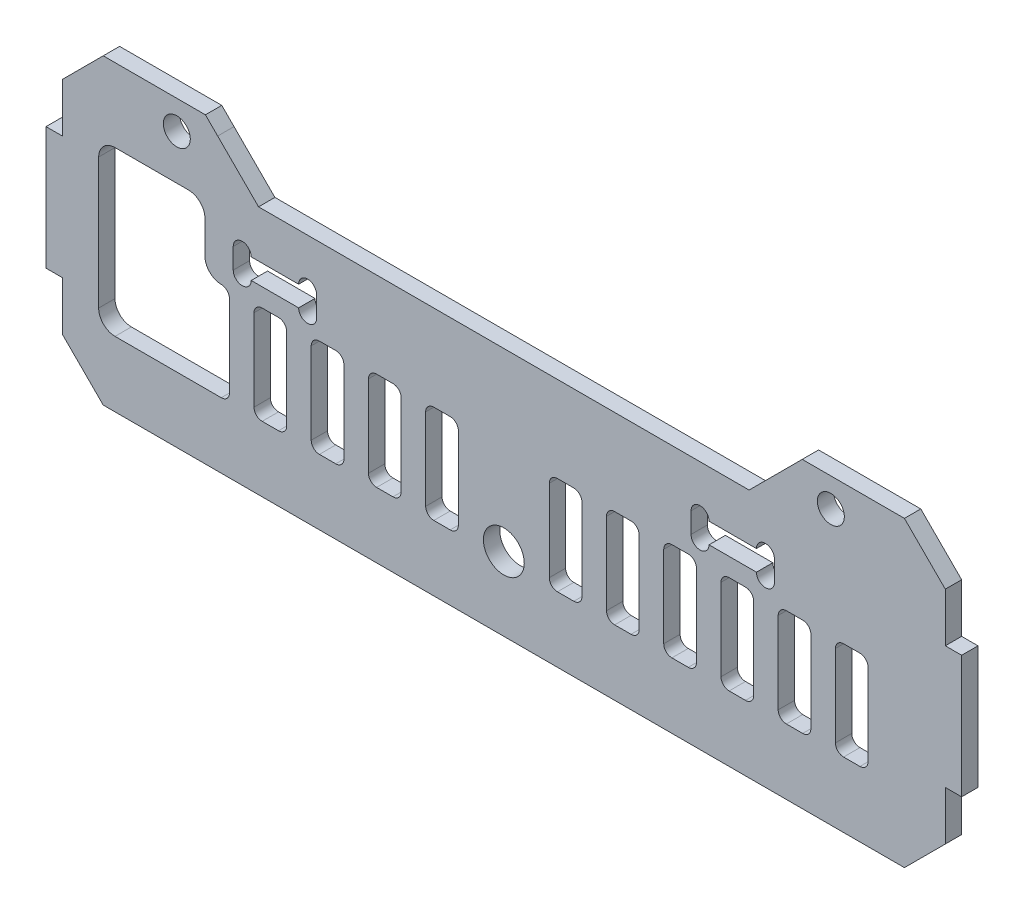
from build123d import *

# Parameters (mm, degrees)
SKETCH_1_W           = 105
SKETCH_1_H           = 43
EXTRUDE_1_DEPTH      = 2
SKETCH_2_R           = 2.5
CUT_EXTRUDE_1_DEPTH  = 2
SKETCH_3_R           = 1.65
CUT_EXTRUDE_2_DEPTH  = 2
CUT_EXTRUDE_3_DEPTH  = 2
CUT_EXTRUDE_4_DEPTH  = 2
SKETCH_7_W           = 119.420279411
SKETCH_7_H           = 10
CUT_EXTRUDE_6_DEPTH  = 2
SKETCH_8_W           = 4.11
SKETCH_8_H           = 33
CUT_EXTRUDE_7_DEPTH  = 2
SKETCH_11_W          = 2
SKETCH_11_H          = 15
EXTRUDE_2_DEPTH      = 2
SKETCH_13_W          = 96.78
SKETCH_13_H          = 6
CUT_EXTRUDE_8_DEPTH  = 2
SKETCH_14_W          = 96.78
SKETCH_14_H          = 10
EXTRUDE_3_DEPTH      = 2
SKETCH_15_R          = 1.65
CUT_EXTRUDE_9_DEPTH  = 10
SKETCH_17_W          = 70
SKETCH_17_H          = 13
CUT_EXTRUDE_10_DEPTH = 50
SKETCH_18_W          = 2
SKETCH_18_H          = 13
SKETCH_18_H_2        = 9
EXTRUDE_4_DEPTH      = 2
SKETCH_19_W          = 2
SKETCH_19_H          = 13
SKETCH_19_H_2        = 9
EXTRUDE_5_DEPTH      = 2
SKETCH_20_W          = 3.61
SKETCH_20_H          = 37
EXTRUDE_6_DEPTH      = 2
SKETCH_21_W          = 4
SKETCH_21_H          = 15
EXTRUDE_7_DEPTH      = 2
CHAMFER_1_SIZE       = 5
CHAMFER_2_SIZE       = 1.5
SKETCH_23_W          = 13
SKETCH_23_H          = 20
CUT_EXTRUDE_12_DEPTH = 10
FILLET_2_R           = 2


with BuildPart() as part:
    # 草图1 → 凸台-拉伸1 (new body)
    with BuildSketch(Plane.XY):
        Rectangle(SKETCH_1_W, SKETCH_1_H)
    extrude(amount=EXTRUDE_1_DEPTH)

    # 草图2 → 切除-拉伸1 (cut)
    with BuildSketch(Plane.XY.offset(2)):
        with Locations((0, -6.5)):
            Circle(SKETCH_2_R)
    extrude(amount=-CUT_EXTRUDE_1_DEPTH, mode=Mode.SUBTRACT)

    # 草图3 → 切除-拉伸2 (cut)
    with BuildSketch(Plane.XY.offset(2)):
        with Locations((-40, -18.5)):
            Circle(SKETCH_3_R)
        with Locations((-40, 13.5)):
            Circle(SKETCH_3_R)
        with Locations(Location((40, 13.5, 0), (0, 0, 180))):
            Circle(SKETCH_3_R)
        with Locations(Location((40, -18.5, 0), (0, 0, 180))):
            Circle(SKETCH_3_R)
    extrude(amount=-CUT_EXTRUDE_2_DEPTH, mode=Mode.SUBTRACT)

    # 草图4 → 切除-拉伸3 (cut)
    with BuildSketch(Plane.XY.offset(2)):
        with BuildLine():
            Line((-6.55922156, -7.5), (-8.55922156, -7.5))
            ThreePointArc((-8.55922156, -7.5), (-9.266328341, -7.207106781), (-9.55922156, -6.5))
            Line((-9.55922156, -6.5), (-9.55922156, 3.5))
            ThreePointArc((-9.55922156, 3.5), (-9.266328341, 4.207106781), (-8.55922156, 4.5))
            Line((-8.55922156, 4.5), (-6.55922156, 4.5))
            ThreePointArc((-6.55922156, 4.5), (-5.852114779, 4.207106781), (-5.55922156, 3.5))
            Line((-5.55922156, 3.5), (-5.55922156, -6.5))
            ThreePointArc((-5.55922156, -6.5), (-5.852114779, -7.207106781), (-6.55922156, -7.5))
        make_face()
        with BuildLine():
            Line((-12.55922156, -6.5), (-12.55922156, 3.5))
            ThreePointArc((-12.55922156, 3.5), (-12.852114779, 4.207106781), (-13.55922156, 4.5))
            Line((-13.55922156, 4.5), (-15.55922156, 4.5))
            ThreePointArc((-15.55922156, 4.5), (-16.266328341, 4.207106781), (-16.55922156, 3.5))
            Line((-16.55922156, 3.5), (-16.55922156, -6.5))
            ThreePointArc((-16.55922156, -6.5), (-16.266328341, -7.207106781), (-15.55922156, -7.5))
            Line((-15.55922156, -7.5), (-13.55922156, -7.5))
            ThreePointArc((-13.55922156, -7.5), (-12.852114779, -7.207106781), (-12.55922156, -6.5))
        make_face()
        with BuildLine():
            Line((-19.55922156, -6.5), (-19.55922156, 3.5))
            ThreePointArc((-19.55922156, 3.5), (-19.852114779, 4.207106781), (-20.55922156, 4.5))
            Line((-20.55922156, 4.5), (-22.55922156, 4.5))
            ThreePointArc((-22.55922156, 4.5), (-23.266328341, 4.207106781), (-23.55922156, 3.5))
            Line((-23.55922156, 3.5), (-23.55922156, -6.5))
            ThreePointArc((-23.55922156, -6.5), (-23.266328341, -7.207106781), (-22.55922156, -7.5))
            Line((-22.55922156, -7.5), (-20.55922156, -7.5))
            ThreePointArc((-20.55922156, -7.5), (-19.852114779, -7.207106781), (-19.55922156, -6.5))
        make_face()
        with BuildLine():
            Line((-26.55922156, -6.5), (-26.55922156, 3.5))
            ThreePointArc((-26.55922156, 3.5), (-26.852114779, 4.207106781), (-27.55922156, 4.5))
            Line((-27.55922156, 4.5), (-29.55922156, 4.5))
            ThreePointArc((-29.55922156, 4.5), (-30.266328341, 4.207106781), (-30.55922156, 3.5))
            Line((-30.55922156, 3.5), (-30.55922156, -6.5))
            ThreePointArc((-30.55922156, -6.5), (-30.266328341, -7.207106781), (-29.55922156, -7.5))
            Line((-29.55922156, -7.5), (-27.55922156, -7.5))
            ThreePointArc((-27.55922156, -7.5), (-26.852114779, -7.207106781), (-26.55922156, -6.5))
        make_face()
        with BuildLine():
            Line((-33.55922156, -6.5), (-33.55922156, 3.5))
            ThreePointArc((-33.55922156, 3.5), (-33.852114779, 4.207106781), (-34.55922156, 4.5))
            Line((-34.55922156, 4.5), (-36.55922156, 4.5))
            ThreePointArc((-36.55922156, 4.5), (-37.266328341, 4.207106781), (-37.55922156, 3.5))
            Line((-37.55922156, 3.5), (-37.55922156, -6.5))
            ThreePointArc((-37.55922156, -6.5), (-37.266328341, -7.207106781), (-36.55922156, -7.5))
            Line((-36.55922156, -7.5), (-34.55922156, -7.5))
            ThreePointArc((-34.55922156, -7.5), (-33.852114779, -7.207106781), (-33.55922156, -6.5))
        make_face()
        with BuildLine():
            Line((-40.55922156, -6.5), (-40.55922156, 3.5))
            ThreePointArc((-40.55922156, 3.5), (-40.852114779, 4.207106781), (-41.55922156, 4.5))
            Line((-41.55922156, 4.5), (-43.55922156, 4.5))
            ThreePointArc((-43.55922156, 4.5), (-44.266328341, 4.207106781), (-44.55922156, 3.5))
            Line((-44.55922156, 3.5), (-44.55922156, -6.5))
            ThreePointArc((-44.55922156, -6.5), (-44.266328341, -7.207106781), (-43.55922156, -7.5))
            Line((-43.55922156, -7.5), (-41.55922156, -7.5))
            ThreePointArc((-41.55922156, -7.5), (-40.852114779, -7.207106781), (-40.55922156, -6.5))
        make_face()
        with BuildLine():
            Line((41.55922156, 4.5), (43.55922156, 4.5))
            ThreePointArc((43.55922156, 4.5), (44.266328341, 4.207106781), (44.55922156, 3.5))
            Line((44.55922156, 3.5), (44.55922156, -6.5))
            ThreePointArc((44.55922156, -6.5), (44.266328341, -7.207106781), (43.55922156, -7.5))
            Line((43.55922156, -7.5), (41.55922156, -7.5))
            ThreePointArc((41.55922156, -7.5), (40.852114779, -7.207106781), (40.55922156, -6.5))
            Line((40.55922156, -6.5), (40.55922156, 3.5))
            ThreePointArc((40.55922156, 3.5), (40.852114779, 4.207106781), (41.55922156, 4.5))
        make_face()
        with BuildLine():
            Line((34.55922156, 4.5), (36.55922156, 4.5))
            ThreePointArc((36.55922156, 4.5), (37.266328341, 4.207106781), (37.55922156, 3.5))
            Line((37.55922156, 3.5), (37.55922156, -6.5))
            ThreePointArc((37.55922156, -6.5), (37.266328341, -7.207106781), (36.55922156, -7.5))
            Line((36.55922156, -7.5), (34.55922156, -7.5))
            ThreePointArc((34.55922156, -7.5), (33.852114779, -7.207106781), (33.55922156, -6.5))
            Line((33.55922156, -6.5), (33.55922156, 3.5))
            ThreePointArc((33.55922156, 3.5), (33.852114779, 4.207106781), (34.55922156, 4.5))
        make_face()
        with BuildLine():
            Line((27.55922156, 4.5), (29.55922156, 4.5))
            ThreePointArc((29.55922156, 4.5), (30.266328341, 4.207106781), (30.55922156, 3.5))
            Line((30.55922156, 3.5), (30.55922156, -6.5))
            ThreePointArc((30.55922156, -6.5), (30.266328341, -7.207106781), (29.55922156, -7.5))
            Line((29.55922156, -7.5), (27.55922156, -7.5))
            ThreePointArc((27.55922156, -7.5), (26.852114779, -7.207106781), (26.55922156, -6.5))
            Line((26.55922156, -6.5), (26.55922156, 3.5))
            ThreePointArc((26.55922156, 3.5), (26.852114779, 4.207106781), (27.55922156, 4.5))
        make_face()
        with BuildLine():
            Line((20.55922156, 4.5), (22.55922156, 4.5))
            ThreePointArc((22.55922156, 4.5), (23.266328341, 4.207106781), (23.55922156, 3.5))
            Line((23.55922156, 3.5), (23.55922156, -6.5))
            ThreePointArc((23.55922156, -6.5), (23.266328341, -7.207106781), (22.55922156, -7.5))
            Line((22.55922156, -7.5), (20.55922156, -7.5))
            ThreePointArc((20.55922156, -7.5), (19.852114779, -7.207106781), (19.55922156, -6.5))
            Line((19.55922156, -6.5), (19.55922156, 3.5))
            ThreePointArc((19.55922156, 3.5), (19.852114779, 4.207106781), (20.55922156, 4.5))
        make_face()
        with BuildLine():
            Line((13.55922156, 4.5), (15.55922156, 4.5))
            ThreePointArc((15.55922156, 4.5), (16.266328341, 4.207106781), (16.55922156, 3.5))
            Line((16.55922156, 3.5), (16.55922156, -6.5))
            ThreePointArc((16.55922156, -6.5), (16.266328341, -7.207106781), (15.55922156, -7.5))
            Line((15.55922156, -7.5), (13.55922156, -7.5))
            ThreePointArc((13.55922156, -7.5), (12.852114779, -7.207106781), (12.55922156, -6.5))
            Line((12.55922156, -6.5), (12.55922156, 3.5))
            ThreePointArc((12.55922156, 3.5), (12.852114779, 4.207106781), (13.55922156, 4.5))
        make_face()
        with BuildLine():
            Line((9.55922156, -6.5), (9.55922156, 3.5))
            ThreePointArc((9.55922156, 3.5), (9.266328341, 4.207106781), (8.55922156, 4.5))
            Line((8.55922156, 4.5), (6.55922156, 4.5))
            ThreePointArc((6.55922156, 4.5), (5.852114779, 4.207106781), (5.55922156, 3.5))
            Line((5.55922156, 3.5), (5.55922156, -6.5))
            ThreePointArc((5.55922156, -6.5), (5.852114779, -7.207106781), (6.55922156, -7.5))
            Line((6.55922156, -7.5), (8.55922156, -7.5))
            ThreePointArc((8.55922156, -7.5), (9.266328341, -7.207106781), (9.55922156, -6.5))
        make_face()
    extrude(amount=-CUT_EXTRUDE_3_DEPTH, mode=Mode.SUBTRACT)

    # 草图5 → 切除-拉伸4 (cut)
    with BuildSketch(Plane.XY.offset(2)):
        with BuildLine():
            Line((-25.100000106, 6.749999873), (-30.900000106, 6.749999873))
            ThreePointArc((-30.900000106, 6.749999873), (-32.000000106, 5.649999873), (-33.100000106, 6.749999873))
            Line((-33.100000106, 6.749999873), (-33.100000106, 9.249999977))
            ThreePointArc((-33.100000106, 9.249999977), (-32.000000106, 10.349999977), (-30.900000106, 9.249999977))
            Line((-30.900000106, 9.249999977), (-25.100000106, 9.249999977))
            ThreePointArc((-25.100000106, 9.249999977), (-24.000000156, 10.349999977), (-22.900000106, 9.250000075))
            Line((-22.900000106, 9.250000075), (-22.900000106, 6.750000075))
            ThreePointArc((-22.900000106, 6.750000075), (-24.000000005, 5.649999873), (-25.100000106, 6.749999873))
        make_face()
        with BuildLine():
            Line((22.900000106, 6.750000075), (22.900000106, 9.250000075))
            ThreePointArc((22.900000106, 9.250000075), (24.000000156, 10.349999977), (25.100000106, 9.249999977))
            Line((25.100000106, 9.249999977), (30.900000106, 9.249999977))
            ThreePointArc((30.900000106, 9.249999977), (32.000000106, 10.349999977), (33.100000106, 9.249999977))
            Line((33.100000106, 9.249999977), (33.100000106, 6.749999873))
            ThreePointArc((33.100000106, 6.749999873), (32.000000106, 5.649999873), (30.900000106, 6.749999873))
            Line((30.900000106, 6.749999873), (25.100000106, 6.749999873))
            ThreePointArc((25.100000106, 6.749999873), (24.000000005, 5.649999873), (22.900000106, 6.750000075))
        make_face()
    extrude(amount=-CUT_EXTRUDE_4_DEPTH, mode=Mode.SUBTRACT)

    # 草图7 → 切除-拉伸6 (cut)
    with BuildSketch(Plane.XY.offset(2)):
        with Locations((5.815039628, 16.5)):
            Rectangle(SKETCH_7_W, SKETCH_7_H)
    extrude(amount=-CUT_EXTRUDE_6_DEPTH, mode=Mode.SUBTRACT)

    # 草图8 → 切除-拉伸7 (cut)
    with BuildSketch(Plane.XY.offset(2)):
        with Locations((-50.445, -5)):
            Rectangle(SKETCH_8_W, SKETCH_8_H)
        with Locations((50.445, -5)):
            Rectangle(SKETCH_8_W, SKETCH_8_H)
    extrude(amount=-CUT_EXTRUDE_7_DEPTH, mode=Mode.SUBTRACT)

    # 草图11 → 凸台-拉伸2 (add)
    with BuildSketch(Plane.XY.offset(2)):
        with Locations((-49.39, 1)):
            Rectangle(SKETCH_11_W, SKETCH_11_H)
        with Locations((49.39, 1)):
            Rectangle(SKETCH_11_W, SKETCH_11_H)
    extrude(amount=-EXTRUDE_2_DEPTH)

    # 草图13 → 切除-拉伸8 (cut)
    with BuildSketch(Plane(origin=(0, 0, 0), x_dir=(-1, 0, 0), z_dir=(0, 0, -1))):
        with Locations((0, -18.5)):
            Rectangle(SKETCH_13_W, SKETCH_13_H)
    extrude(amount=-CUT_EXTRUDE_8_DEPTH, mode=Mode.SUBTRACT)

    # 草图14 → 凸台-拉伸3 (add)
    with BuildSketch(Plane(origin=(0, 0, 0), x_dir=(-1, 0, 0), z_dir=(0, 0, -1))):
        with Locations((0, 16.5)):
            Rectangle(SKETCH_14_W, SKETCH_14_H)
    extrude(amount=-EXTRUDE_3_DEPTH)

    # 草图15 → 切除-拉伸9 (cut)
    with BuildSketch(Plane(origin=(0, 0, 0), x_dir=(-1, 0, 0), z_dir=(0, 0, -1))):
        with Locations((-40, 18)):
            Circle(SKETCH_15_R)
        with Locations((40, 18)):
            Circle(SKETCH_15_R)
    extrude(amount=-CUT_EXTRUDE_9_DEPTH, mode=Mode.SUBTRACT)

    # 草图17 → 切除-拉伸10 (cut)
    with BuildSketch(Plane(origin=(0, 0, 0), x_dir=(-1, 0, 0), z_dir=(0, 0, -1))):
        with Locations((0, 21.5)):
            Rectangle(SKETCH_17_W, SKETCH_17_H)
    extrude(amount=-CUT_EXTRUDE_10_DEPTH, mode=Mode.SUBTRACT)

    # 草图18 → 凸台-拉伸4 (add)
    with BuildSketch(Plane.ZY.offset(48.39)):
        with Locations((1, 15)):
            Rectangle(SKETCH_18_W, SKETCH_18_H)
        with Locations((1, -11)):
            Rectangle(SKETCH_18_W, SKETCH_18_H_2)
    extrude(amount=EXTRUDE_4_DEPTH)

    # 草图19 → 凸台-拉伸5 (add)
    with BuildSketch(Plane(origin=(48.39, 0, 0), x_dir=(0, 0, -1), z_dir=(1, 0, 0))):
        with Locations((-1, 15)):
            Rectangle(SKETCH_19_W, SKETCH_19_H)
        with Locations((-1, -11)):
            Rectangle(SKETCH_19_W, SKETCH_19_H_2)
    extrude(amount=EXTRUDE_5_DEPTH)

    # 草图20 → 凸台-拉伸6 (add)
    with BuildSketch(Plane.XY.offset(2)):
        with Locations((-52.195, 3)):
            Rectangle(SKETCH_20_W, SKETCH_20_H)
        with Locations((52.195, 3)):
            Rectangle(SKETCH_20_W, SKETCH_20_H)
    extrude(amount=-EXTRUDE_6_DEPTH)

    # 草图21 → 凸台-拉伸7 (add)
    with BuildSketch(Plane.XY.offset(2)):
        with Locations((-54, 3)):
            Rectangle(SKETCH_21_W, SKETCH_21_H)
        with Locations((54, 3)):
            Rectangle(SKETCH_21_W, SKETCH_21_H)
    extrude(amount=-EXTRUDE_7_DEPTH)

    # 倒角1
    chamfer_1_edges = [part.edges().sort_by_distance(p)[0] for p in [
        (35, 15, 1),
        (-35, 15, 1),
        (-54, -15.5, 1),
        (-54, 21.5, 1),
        (54, 21.5, 1),
        (54, -15.5, 1),
    ]]
    chamfer(chamfer_1_edges, length=CHAMFER_1_SIZE)

    # 倒角2
    chamfer_2_edges = [part.edges().sort_by_distance(p)[0] for p in [
        (-35, 21.5, 1),
        (35, 21.5, 1),
    ]]
    chamfer(chamfer_2_edges, length=CHAMFER_2_SIZE - 0.0001)  # a hair under: the kernel refuses the full size

    # 草图23 → 切除-拉伸12 (cut)
    with BuildSketch(Plane.XY.offset(2)):
        with Locations((-43.05922156, 2.5)):
            Rectangle(SKETCH_23_W, SKETCH_23_H)
    extrude(amount=-CUT_EXTRUDE_12_DEPTH, mode=Mode.SUBTRACT)

    # 圆角2
    fillet_2_edges = [part.edges().sort_by_distance(p)[0] for p in [
        (-49.55922156, -7.5, 1),
        (-49.55922156, 12.5, 1),
        (-36.55922156, 12.5, 1),
        (-36.55922156, 4.5, 1),
    ]]
    fillet(fillet_2_edges, radius=FILLET_2_R - 0.0001)  # a hair under: the kernel refuses the full size


solid = part.part
